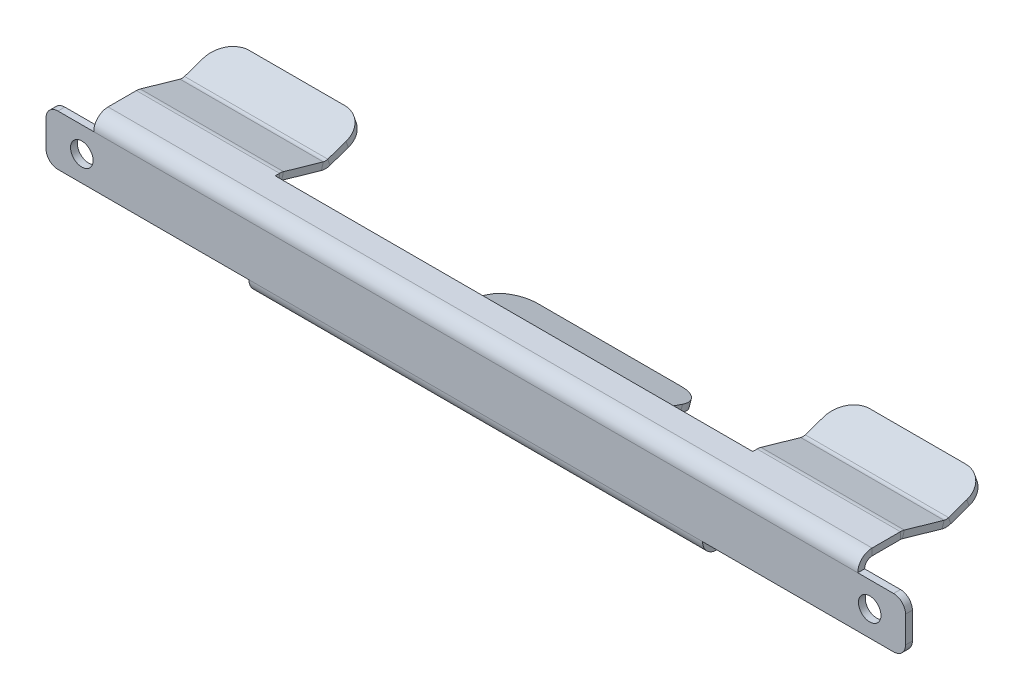
from build123d import *

# Parameters (mm, degrees)
SKETCH1_W                                 = 0.91186
SKETCH1_H                                 = 6.731
BASE_FLANGE1_DEPTH                        = 57.15
EDGE_FLANGE1_DEPTH                        = 101.6
EDGE_FLANGE2_DEPTH                        = 101.6
EDGE_FLANGE3_DEPTH                        = 101.6
CUT_EXTRUDE1_START                        = -2.539504
SKETCH21_W                                = 63.5
SKETCH21_H                                = 12.718519465
CUT_EXTRUDE1_DEPTH                        = 2.836243
EDGE_FLANGE4_DEPTH                        = 60.325
EDGE_FLANGE5_DEPTH                        = 25.4
EDGE_FLANGE6_DEPTH                        = 25.4
BREAK_CORNER3_START                       = 0.436452344
BREAK_CORNER3_DEPTH                       = 0.91186
BREAK_CORNER3_START_2                     = -1.348312344
BREAK_CORNER3_2_DEPTH                     = 0.91186
BREAK_CORNER4_START                       = -5.26796
BREAK_CORNER4_DEPTH                       = 0.91186
BREAK_CORNER4_START_2                     = -0.91186
BREAK_CORNER4_2_DEPTH                     = 0.91186
HOLE_FOR_M3_FLUSH_HEAD_STUDS_FH_FHS_FHA_D = 3


# Read off the part's stored shape, not the designer's step: Break-Corner3, Break-Corner4
# Sheet-metal steps are written as plain solids
with BuildPart() as part:
    # Sketch1 → Base-Flange1 (new, symmetric)
    with BuildSketch(Plane(origin=(0, 0, 0), x_dir=(0, 0, -1), z_dir=(1, 0, 0))):
        with Locations((0.45593, 0)):
            Rectangle(SKETCH1_W, SKETCH1_H)
    extrude(amount=BASE_FLANGE1_DEPTH, both=True)

    # Edge-Flange1 section (across the edge) → Edge-Flange1 (add)
    with BuildSketch(Plane(origin=(-50.8, 4.3561, -0.91186), x_dir=(0, -1, 0), z_dir=(1, 0, 0))):
        with BuildLine():
            Line((-0.91186, 0.9906), (-0.91186, 4.75234))
            Line((-0.91186, 4.75234), (0, 4.75234))
            Line((0, 4.75234), (0, 0.9906))
            ThreePointArc((0, 0.9906), (0.290140023, 0.290140023), (0.9906, 0))
            Line((0.9906, 0), (0.9906, -0.91186))
            ThreePointArc((0.9906, -0.91186), (-0.354642367, -0.354642367), (-0.91186, 0.9906))
        make_face()
    extrude(amount=EDGE_FLANGE1_DEPTH)

    # Edge-Flange2 section (across the edge) → Edge-Flange2 (add)
    with BuildSketch(Plane(origin=(-50.8, 4.3561, -5.803419751), x_dir=(0, -0.9612616959383217, 0.27563735581698934), z_dir=(1, 0, 0))):
        with BuildLine():
            Line((-0.91186, 0.139219751), (-0.91186, 5.637646434))
            Line((-0.91186, 5.637646434), (0, 5.637646434))
            Line((0, 5.637646434), (0, 0.139219751))
            ThreePointArc((0, 0.139219751), (0.009640451, 0.001354877), (0.038374164, -0.133826614))
            Line((0.038374164, -0.133826614), (-0.838161926, -0.385169293))
            ThreePointArc((-0.838161926, -0.385169293), (-0.89334539, -0.125551507), (-0.91186, 0.139219751))
        make_face()
    extrude(amount=EDGE_FLANGE2_DEPTH)

    # Edge-Flange3 section (across the edge) → Edge-Flange3 (add)
    with BuildSketch(Plane(origin=(50.8, 3.592598946, -11.774251656), x_dir=(0, 0.9455185755993153, 0.32556815445716125), z_dir=(-1, 0, 0))):
        with BuildLine():
            Line((-0.91186, 0.31233498), (-0.91186, 6.057411646))
            Line((-0.91186, 6.057411646), (0, 6.057411646))
            Line((0, 6.057411646), (0, 0.31233498))
            ThreePointArc((0, 0.31233498), (0.045847989, 0.014455815), (0.179147985, -0.255849838))
            Line((0.179147985, -0.255849838), (-0.567803998, -0.778871247))
            ThreePointArc((-0.567803998, -0.778871247), (-0.82380835, -0.259745775), (-0.91186, 0.31233498))
        make_face()
    extrude(amount=EDGE_FLANGE3_DEPTH)

    # Sketch21 → Cut-Extrude1 (cut)
    with BuildSketch(Plane(origin=(0, 5.26796, 0), x_dir=(1, 0, 0), z_dir=(0, 1, 0)).offset(CUT_EXTRUDE1_START)):
        with Locations((0, 11.439259733)):
            Rectangle(SKETCH21_W, SKETCH21_H)
    extrude(amount=CUT_EXTRUDE1_DEPTH, mode=Mode.SUBTRACT)

    # Edge-Flange4 section (across the edge) → Edge-Flange4 (add)
    with BuildSketch(Plane(origin=(30.1625, -4.3561, -0.91186), x_dir=(0, 1, 0), z_dir=(-1, 0, 0))):
        with BuildLine():
            Line((-0.91186, 0.9906), (-0.91186, 4.16814))
            Line((-0.91186, 4.16814), (0, 4.16814))
            Line((0, 4.16814), (0, 0.9906))
            ThreePointArc((0, 0.9906), (0.290140023, 0.290140023), (0.9906, 0))
            Line((0.9906, 0), (0.9906, -0.91186))
            ThreePointArc((0.9906, -0.91186), (-0.354642367, -0.354642367), (-0.91186, 0.9906))
        make_face()
    extrude(amount=EDGE_FLANGE4_DEPTH)

    # Edge-Flange5 section (across the edge) → Edge-Flange5 (add)
    with BuildSketch(Plane(origin=(12.7, -4.3561, -5.803419751), x_dir=(0, 0.9612616959383217, 0.27563735581698967), z_dir=(-1, 0, 0))):
        with BuildLine():
            Line((-0.91186, 0.139219751), (-0.91186, 5.637646434))
            Line((-0.91186, 5.637646434), (0, 5.637646434))
            Line((0, 5.637646434), (0, 0.139219751))
            ThreePointArc((0, 0.139219751), (0.009640451, 0.001354877), (0.038374164, -0.133826614))
            Line((0.038374164, -0.133826614), (0.199401507, -0.695395697))
            Line((0.199401507, -0.695395697), (-0.677134583, -0.946738376))
            Line((-0.677134583, -0.946738376), (-0.838161926, -0.385169293))
            ThreePointArc((-0.838161926, -0.385169293), (-0.89334539, -0.125551507), (-0.91186, 0.139219751))
        make_face()
    extrude(amount=EDGE_FLANGE5_DEPTH)

    # Edge-Flange6 section (across the edge) → Edge-Flange6 (add)
    with BuildSketch(Plane(origin=(-12.7, -3.592598946, -11.774251656), x_dir=(0, -0.9455185755993154, 0.325568154457161), z_dir=(1, 0, 0))):
        with BuildLine():
            Line((-0.91186, 0.31233498), (-0.91186, 6.062491646))
            Line((-0.91186, 6.062491646), (0, 6.062491646))
            Line((0, 6.062491646), (0, 0.31233498))
            ThreePointArc((0, 0.31233498), (0.045847989, 0.014455815), (0.179147985, -0.255849838))
            Line((0.179147985, -0.255849838), (-0.567803998, -0.778871247))
            ThreePointArc((-0.567803998, -0.778871247), (-0.82380835, -0.259745775), (-0.91186, 0.31233498))
        make_face()
    extrude(amount=EDGE_FLANGE6_DEPTH)

    # Break-Corner3 outline → Break-Corner3 (cut)
    with BuildSketch(Plane(origin=(0, 0, 0), x_dir=(1, 0, 0), z_dir=(0, 0.9455185755993153, -0.3255681544571611)).offset(BREAK_CORNER3_START)):
        with BuildLine():
            Line((12.7, 18.364901109), (9.525, 18.364901109))
            ThreePointArc((9.525, 18.364901109), (11.77006403, 17.434965139), (12.7, 15.189901109))
            Line((12.7, 15.189901109), (12.7, 18.364901109))
        make_face()
        with BuildLine():
            ThreePointArc((-12.7, 15.189901109), (-11.77006403, 17.434965139), (-9.525, 18.364901109))
            Line((-9.525, 18.364901109), (-12.7, 18.364901109))
            Line((-12.7, 18.364901109), (-12.7, 15.189901109))
        make_face()
    extrude(amount=BREAK_CORNER3_DEPTH, mode=Mode.SUBTRACT)

    # Break-Corner3 2 outline → Break-Corner3 2 (cut)
    with BuildSketch(Plane(origin=(0, 0, 0), x_dir=(1, 0, 0), z_dir=(0, 0.9455185755993153, 0.3255681544571611)).offset(BREAK_CORNER3_START_2)):
        with BuildLine():
            ThreePointArc((-50.8, 15.184821109), (-49.87006403, 17.429885139), (-47.625, 18.359821109))
            Line((-47.625, 18.359821109), (-50.8, 18.359821109))
            Line((-50.8, 18.359821109), (-50.8, 15.184821109))
        make_face()
        with BuildLine():
            Line((-31.75, 18.359821109), (-34.925, 18.359821109))
            ThreePointArc((-34.925, 18.359821109), (-32.67993597, 17.429885139), (-31.75, 15.184821109))
            Line((-31.75, 15.184821109), (-31.75, 18.359821109))
        make_face()
        with BuildLine():
            Line((31.75, 18.359821109), (31.75, 15.184821109))
            ThreePointArc((31.75, 15.184821109), (32.67993597, 17.429885139), (34.925, 18.359821109))
            Line((34.925, 18.359821109), (31.75, 18.359821109))
        make_face()
        with BuildLine():
            Line((50.8, 18.359821109), (47.625, 18.359821109))
            ThreePointArc((47.625, 18.359821109), (49.87006403, 17.429885139), (50.8, 15.184821109))
            Line((50.8, 15.184821109), (50.8, 18.359821109))
        make_face()
    extrude(amount=BREAK_CORNER3_2_DEPTH, mode=Mode.SUBTRACT)

    # Break-Corner4 outline → Break-Corner4 (cut)
    with BuildSketch(Plane(origin=(0, 0, 0), x_dir=(1, 0, 0), z_dir=(0, 1, 0)).offset(BREAK_CORNER4_START)):
        with BuildLine():
            ThreePointArc((28.575, 5.08), (29.697532015, 4.615032015), (30.1625, 3.4925))
            Line((30.1625, 3.4925), (30.1625, 5.08))
            Line((30.1625, 5.08), (28.575, 5.08))
        make_face()
        with BuildLine():
            ThreePointArc((-30.1625, 3.4925), (-29.697532015, 4.615032015), (-28.575, 5.08))
            Line((-28.575, 5.08), (-30.1625, 5.08))
            Line((-30.1625, 5.08), (-30.1625, 3.4925))
        make_face()
    extrude(amount=BREAK_CORNER4_DEPTH, mode=Mode.SUBTRACT)

    # Break-Corner4 2 outline → Break-Corner4 2 (cut)
    with BuildSketch(Plane.XY.offset(BREAK_CORNER4_START_2)):
        with BuildLine():
            Line((-57.15, 3.3655), (-57.15, 1.778))
            ThreePointArc((-57.15, 1.778), (-56.685032015, 2.900532015), (-55.5625, 3.3655))
            Line((-55.5625, 3.3655), (-57.15, 3.3655))
        make_face()
        with BuildLine():
            ThreePointArc((-55.5625, -3.3655), (-56.685032015, -2.900532015), (-57.15, -1.778))
            Line((-57.15, -1.778), (-57.15, -3.3655))
            Line((-57.15, -3.3655), (-55.5625, -3.3655))
        make_face()
        with BuildLine():
            Line((57.15, -3.3655), (57.15, -1.778))
            ThreePointArc((57.15, -1.778), (56.685032015, -2.900532015), (55.5625, -3.3655))
            Line((55.5625, -3.3655), (57.15, -3.3655))
        make_face()
        with BuildLine():
            ThreePointArc((55.5625, 3.3655), (56.685032015, 2.900532015), (57.15, 1.778))
            Line((57.15, 1.778), (57.15, 3.3655))
            Line((57.15, 3.3655), (55.5625, 3.3655))
        make_face()
    extrude(amount=BREAK_CORNER4_2_DEPTH, mode=Mode.SUBTRACT)

    # Hole for M3 Flush head Studs (FH,FHS,FHA,FH4)1 (through all)
    with Locations(Plane.XY):
        with Locations((52.3875, 0), (-52.3875, 0)):
            Hole(HOLE_FOR_M3_FLUSH_HEAD_STUDS_FH_FHS_FHA_D / 2)


solid = part.part
